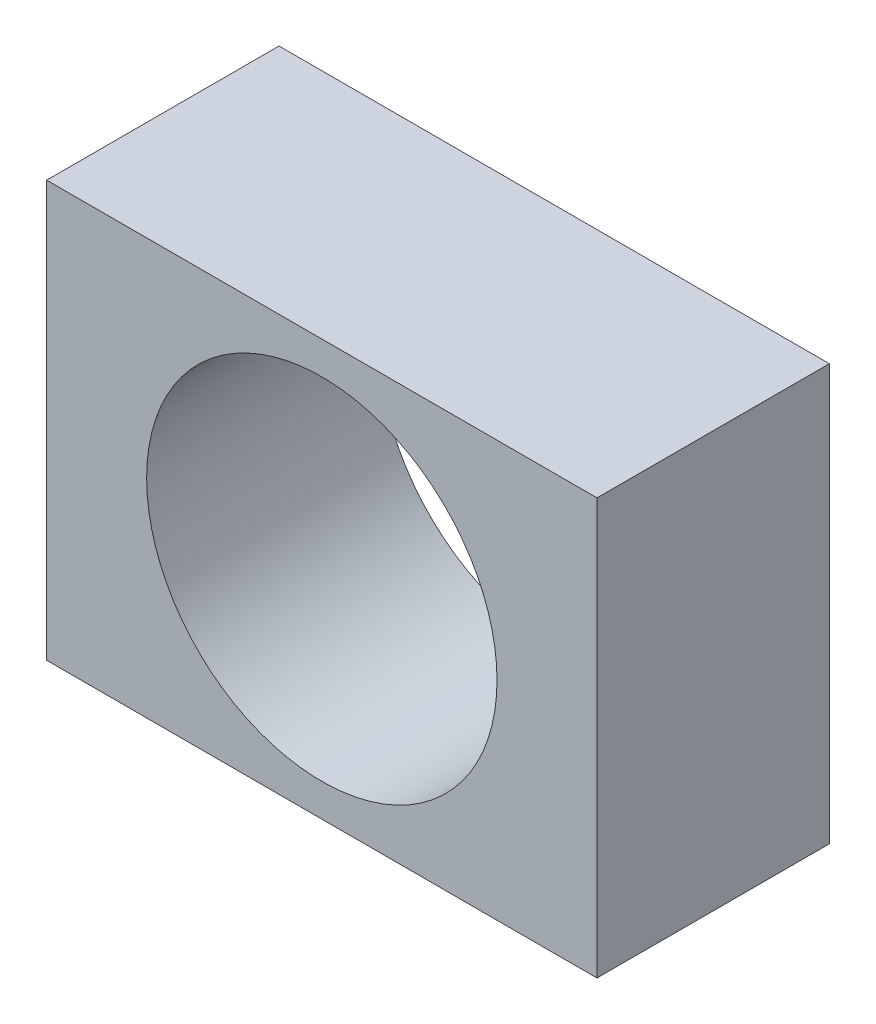
from build123d import *

# Parameters (mm, degrees)
SKETCH1_W           = 90
SKETCH1_H           = 68
SKETCH1_R           = 28.65
BOSS_EXTRUDE1_DEPTH = 19


with BuildPart() as part:
    # Sketch1 → Boss-Extrude1 (new, symmetric)
    with BuildSketch(Plane.XY):
        Rectangle(SKETCH1_W, SKETCH1_H)
        Circle(SKETCH1_R, mode=Mode.SUBTRACT)
    extrude(amount=BOSS_EXTRUDE1_DEPTH, both=True)


solid = part.part
